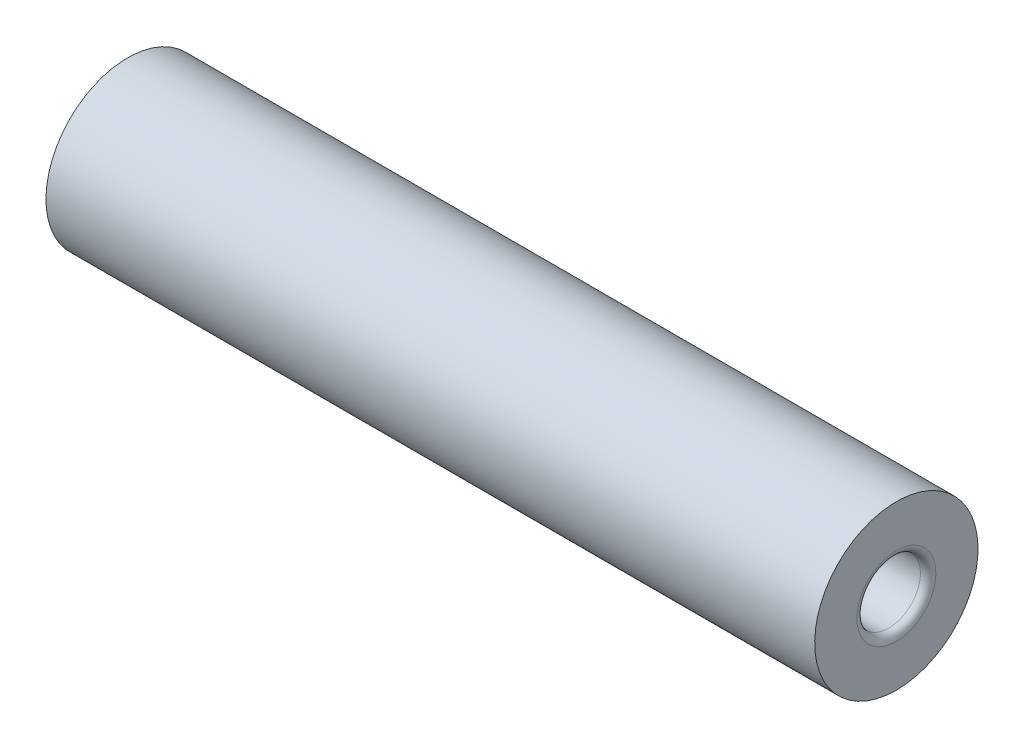
from build123d import *

# Parameters (mm, degrees)
FILLET1_R = 0.508


with BuildPart() as part:
    # Sketch1 → Revolve1 (revolve)
    with BuildSketch(Plane.XY):
        Polygon((0, 0), (0, 5.3975), (50.8, 5.3975), (50.8, 0), (37.892541774, 0), (12.907458226, 0), align=None)
    revolve(axis=Axis((0, 5.3975, 0), (1, 0, 0)))

    # Sketch6 → Tap Drill for M4 Helicoil1 (revolve, cut)
    with BuildSketch(Plane.ZX.offset(5.3975)):
        Polygon((0, 0), (0, 10.1518073), (2.1, 8.89), (2.1, 0), align=None)
    tap_drill_for_m4_helicoil1 = revolve(axis=Axis((-6.35, 5.3975, 0), (1, 0, 0)), mode=Mode.SUBTRACT)

    # Mirror1: Tap Drill for M4 Helicoil1 across plane
    add(tap_drill_for_m4_helicoil1.mirror(Plane.ZY.offset(-25.4)), mode=Mode.SUBTRACT)

    # Fillet1
    fillet1_edges = [part.edges().sort_by_distance(p)[0] for p in [
        (0, 5.3975, -2.1),
        (50.8, 5.3975, -2.1),
    ]]
    fillet(fillet1_edges, radius=FILLET1_R)


solid = part.part
